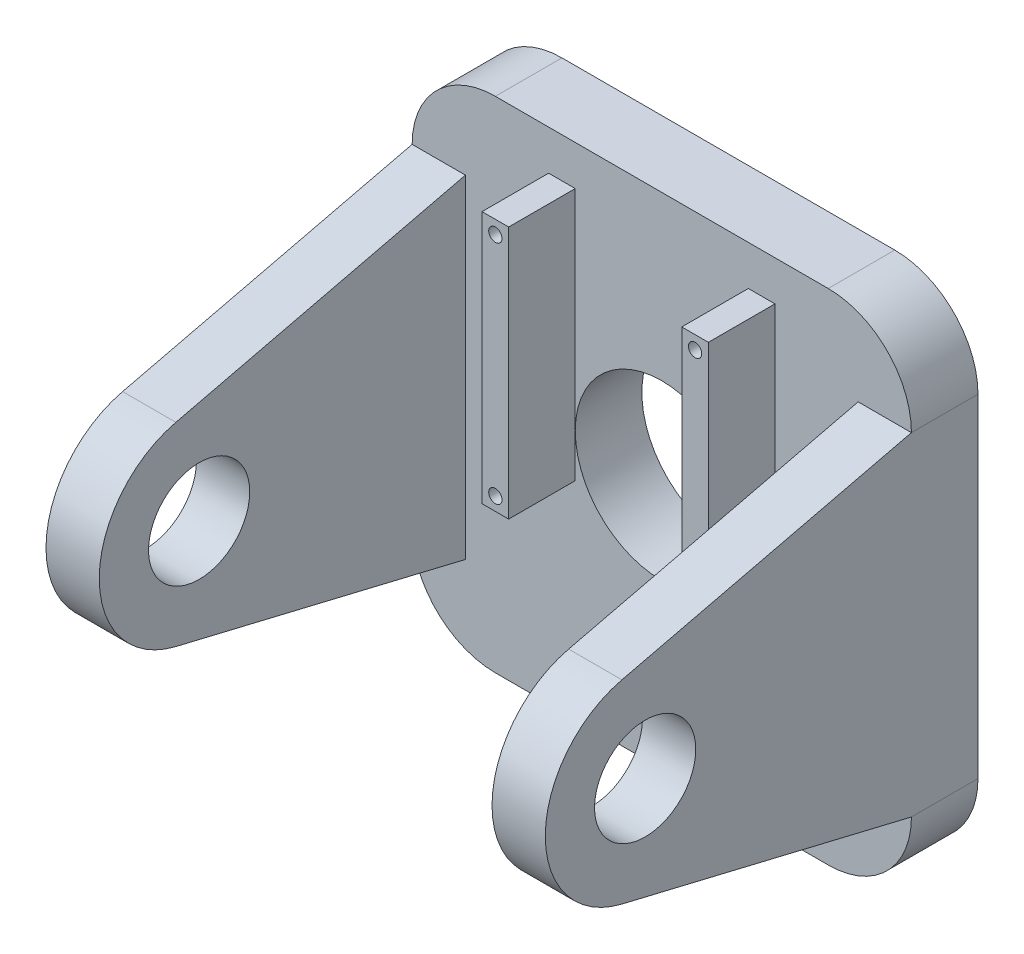
from build123d import *

# Parameters (mm, degrees)
BOSS_EXTRUDE1_DEPTH = 10
SKETCH2_R           = 7.6
BOSS_EXTRUDE2_DEPTH = 8
SKETCH4_R           = 13
CUT_EXTRUDE2_DEPTH  = 77.40353395
SKETCH5_W           = 4
SKETCH5_H           = 38
SKETCH5_R           = 1
BOSS_EXTRUDE3_DEPTH = 10


with BuildPart() as part:
    # Sketch1 → Boss-Extrude1 (new body)
    with BuildSketch(Plane(origin=(0, 0, 0), x_dir=(0, 1, 0), z_dir=(0, 0, 1))):
        with BuildLine():
            Line((-25, -37.5), (25, -37.5))
            ThreePointArc((25, -37.5), (33.838834765, -33.838834765), (37.5, -25))
            Line((37.5, -25), (37.5, 25))
            ThreePointArc((37.5, 25), (33.838834765, 33.838834765), (25, 37.5))
            Line((25, 37.5), (-25, 37.5))
            ThreePointArc((-25, 37.5), (-33.838834765, 33.838834765), (-37.5, 25))
            Line((-37.5, 25), (-37.5, -25))
            ThreePointArc((-37.5, -25), (-33.838834765, -33.838834765), (-25, -37.5))
        make_face()
    extrude(amount=BOSS_EXTRUDE1_DEPTH)

    # Sketch2 → Boss-Extrude2 (add)
    with BuildSketch(Plane.YZ.offset(37.5)):
        with BuildLine():
            ThreePointArc((14.587782351, 53.492363969), (0, 65), (-14.587782351, 53.492363969))
            Line((-14.587782351, 53.492363969), (-25, 10))
            Line((-25, 10), (25, 10))
            Line((25, 10), (14.587782351, 53.492363969))
        make_face()
        with Locations((0, 50)):
            Circle(SKETCH2_R, mode=Mode.SUBTRACT)
    boss_extrude2 = extrude(amount=-BOSS_EXTRUDE2_DEPTH)

    # Mirror1: Boss-Extrude2 across plane
    add(boss_extrude2.mirror(Plane(origin=(0, 0, 0), x_dir=(0, 0, 1), z_dir=(1, 0, 0))))

    # Sketch4 → Cut-Extrude2 (cut, through all)
    with BuildSketch(Plane.XY.offset(10)):
        Circle(SKETCH4_R)
    extrude(amount=-CUT_EXTRUDE2_DEPTH, mode=Mode.SUBTRACT)

    # Sketch5 → Boss-Extrude3 (add)
    # profile 1 of 2: a face of its own
    with BuildSketch(Plane.XY.offset(10)):
        with Locations((-15, 12.5)):
            Rectangle(SKETCH5_W, SKETCH5_H)
        with Locations((-15, -4.5)):
            Circle(SKETCH5_R, mode=Mode.SUBTRACT)
        with Locations((-15, 29.5)):
            Circle(SKETCH5_R, mode=Mode.SUBTRACT)
    # profile 2 of 2: a face of its own
    with BuildSketch(Plane.XY.offset(10)):
        with Locations((15, 12.5)):
            Rectangle(SKETCH5_W, SKETCH5_H)
        with Locations((15, -4.5)):
            Circle(SKETCH5_R, mode=Mode.SUBTRACT)
        with Locations((15, 29.5)):
            Circle(SKETCH5_R, mode=Mode.SUBTRACT)
    extrude(amount=BOSS_EXTRUDE3_DEPTH)


solid = part.part
